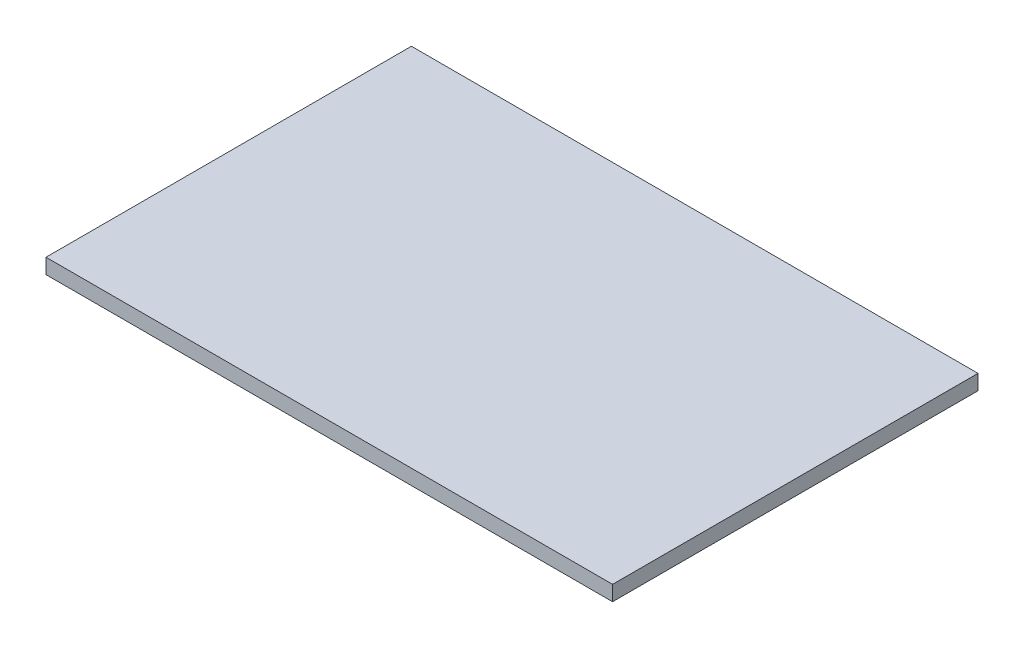
from build123d import *

# Parameters (mm, degrees)
SKETCH1_W           = 338
SKETCH1_H           = 218
BOSS_EXTRUDE1_DEPTH = 9


with BuildPart() as part:
    # Sketch1 → Boss-Extrude1 (new body)
    with BuildSketch(Plane(origin=(0, 0, 0), x_dir=(1, 0, 0), z_dir=(0, 1, 0))):
        Rectangle(SKETCH1_W, SKETCH1_H)
    extrude(amount=BOSS_EXTRUDE1_DEPTH)


solid = part.part
